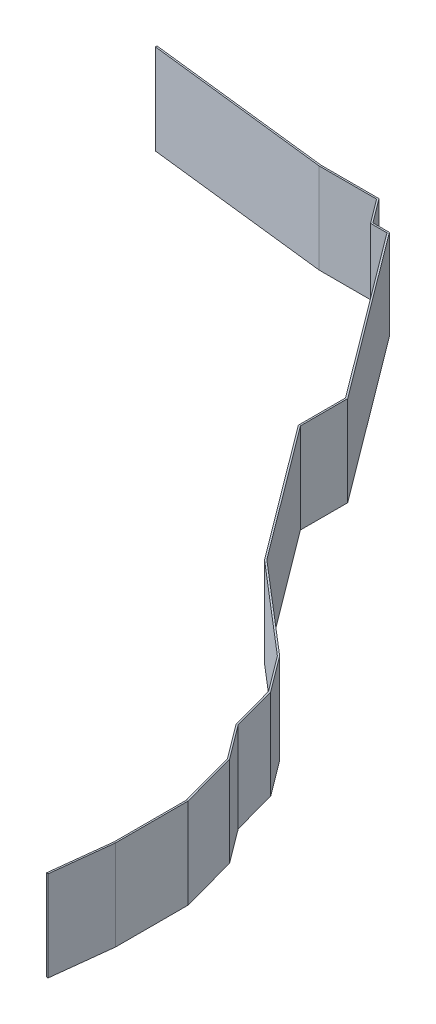
from build123d import *

# Parameters (mm, degrees)
EXTRUDE_THIN1_DEPTH = 143.002
SKETCH2_W           = 353.476809532
SKETCH2_H           = 287.248033411
CUT_EXTRUDE1_DEPTH  = 2.54
SKETCH5_W           = 2.556683639
SKETCH5_H           = 143.002
BOSS_EXTRUDE1_DEPTH = 96.52
SKETCH6_W           = 436.207107494
SKETCH6_H           = 411.415497476
CUT_EXTRUDE3_DEPTH  = 2.54
SKETCH9_W           = 2.54
SKETCH9_H           = 143.002
BOSS_EXTRUDE2_DEPTH = 154.94


with BuildPart() as part:
    # Sketch1 → Extrude-Thin1 (new body)
    with BuildSketch(Plane(origin=(0, 0, 0), x_dir=(1, 0, 0), z_dir=(0, 1, 0))):
        Polygon((429.494620494, -763.000572689), (282.185626339, -746.088969303), (282.185626339, -628.864042129), (257.724926693, -539.38485687), (217.458740987, -485.473629066), (198.09556878, -414.64160471), (156.541730962, -359.006376852), (68.762687355, -283.781976389), (14.14991429, -236.980223457), (-45.64531009, -156.922132367), (-95.860416986, -89.690582628), (-143.704865867, -25.633038127), (-143.704865867, 49.263431443), (-195.539820534, 118.663748365), (-262.069299432, 207.73813745), (-337.521866174, 308.759389966), (-363.661203016, 308.759389966), (-392.100936643, 346.836524201), (-482.977728206, 346.836524201), (-563.408799351, 356.070301017), (-625.019348636, 363.143414101), (-604.768848946, 539.535957871), (-602.245423716, 539.246259561), (-622.206225096, 365.37714102), (-563.119101041, 358.593726247), (-482.832404898, 349.376524201), (-390.827778697, 349.376524201), (-362.38804507, 311.299389966), (-336.248708228, 311.299389966), (-260.03427333, 209.258094281), (-193.504794432, 120.183705196), (-141.164865867, 50.107293372), (-141.164865867, -24.789176199), (-93.825390885, -88.170625798), (-43.610283989, -155.402175536), (16.016487249, -235.234729602), (70.415510233, -281.853304168), (158.408303922, -357.260882997), (200.418710431, -413.50739743), (219.781882638, -484.339421786), (260.048068344, -538.25064959), (284.725626339, -628.523119941), (284.725626339, -743.823886817), (429.784318804, -760.477147459), align=None)
    extrude(amount=-EXTRUDE_THIN1_DEPTH)

    # Sketch2 → Cut-Extrude1 (cut)
    with BuildSketch(Plane(origin=(-80.868694539, 0, 704.409024928), x_dir=(0.9934744998263692, 0, 0.11405445276158947), z_dir=(-0.11405445276158947, 0, 0.9934744998263692))):
        with Locations((435.779818352, -64.905243111)):
            Rectangle(SKETCH2_W, SKETCH2_H)
    extrude(amount=-CUT_EXTRUDE1_DEPTH, mode=Mode.SUBTRACT)

    # Sketch5 → Boss-Extrude1 (add)
    with BuildSketch(Plane(origin=(-80.578996229, 0, 701.885599699), x_dir=(0.9934744998263692, 0, 0.11405445276158968), z_dir=(-0.1140544527615897, 0, 0.9934744998263693))):
        with Locations((366.425733757, -71.501)):
            Rectangle(SKETCH5_W, SKETCH5_H)
    extrude(amount=BOSS_EXTRUDE1_DEPTH)

    # Sketch6 → Cut-Extrude3 (cut)
    with BuildSketch(Plane(origin=(-658.036684967, 0, -75.544982799), x_dir=(-0.11405445276159007, 0, 0.9934744998263692), z_dir=(-0.993474499826369, 0, -0.11405445276159006))):
        with Locations((-358.307764933, -83.68082163)):
            Rectangle(SKETCH6_W, SKETCH6_H)
    extrude(amount=-CUT_EXTRUDE3_DEPTH, mode=Mode.SUBTRACT)

    # Sketch9 → Boss-Extrude2 (add)
    with BuildSketch(Plane(origin=(-655.513259738, 0, -75.255284489), x_dir=(-0.11405445276159011, 0, 0.9934744998263692), z_dir=(-0.993474499826369, 0, -0.1140544527615901))):
        with Locations((-290.757481915, -71.501)):
            Rectangle(SKETCH9_W, SKETCH9_H)
    extrude(amount=BOSS_EXTRUDE2_DEPTH)


solid = part.part
